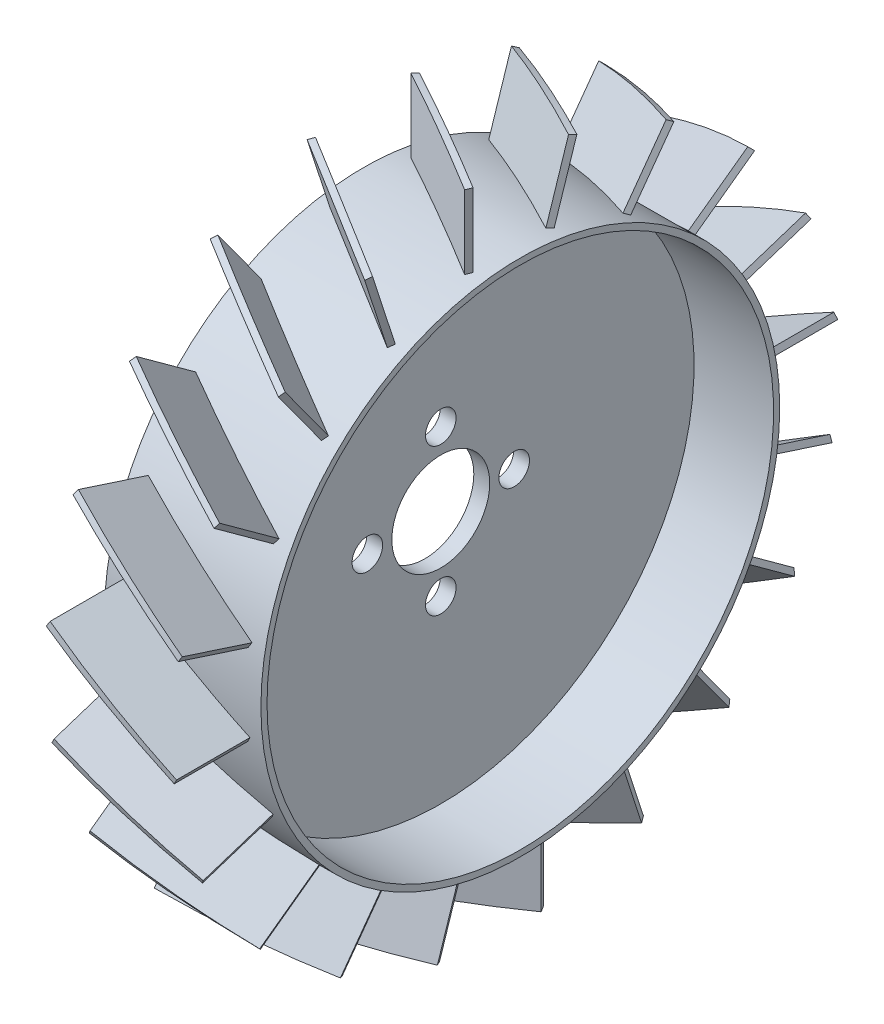
from build123d import *

# Parameters (mm, degrees)
BOSS_EXTRUDE1_REACH        = 166.386
BOSS_EXTRUDE1_START_RADIUS = 53.848
BOSS_EXTRUDE1_END_RADIUS   = 53.848
CIRPATTERN15_COUNT         = 20
SKETCH7_R                  = 3.175
SKETCH7_R_2                = 10.16
CUT_EXTRUDE1_DEPTH         = 100.090279987


with BuildPart() as part:
    # Sketch1 → Revolve1 (revolve)
    with BuildSketch(Plane(origin=(0, 0, 0), x_dir=(1, 0, 0), z_dir=(0, 1, 0))):
        Polygon((3.302, 0), (3.302, 52.578), (19.812, 52.578), (19.812, 53.848), (-12.7, 53.848), (-12.7, 52.578), (0, 52.578), (0, 0), align=None)
    revolve(axis=Axis((0, 0, 0), (1, 0, 0)))

    # Boss-Extrude1: from a cylinder face, 166.386 long prism both ways, kept between that surface and its translate by the depth
    boss_extrude1_start = Plane(origin=(3.556, 0, 0), z_dir=(-1, 0, 0)) * Cylinder(BOSS_EXTRUDE1_START_RADIUS, 441.468, mode=Mode.PRIVATE)
    boss_extrude1_end = Plane(origin=(3.556, 0, 15.24), z_dir=(-1, 0, 0)) * Cylinder(BOSS_EXTRUDE1_END_RADIUS, 441.468, mode=Mode.PRIVATE)
    # Sketch2 → Boss-Extrude1 (add, from a surface)
    with BuildSketch(Plane.XY.offset(83.82), mode=Mode.PRIVATE) as boss_extrude1_sk1:
        Polygon((-9.959727154, 7.070073869), (16.436727154, -8.169926131), (17.071727154, -7.070073869), (-9.324727154, 8.169926131), align=None)
    boss_extrude1_tool1 = extrude(boss_extrude1_sk1.sketch, amount=BOSS_EXTRUDE1_REACH, both=True, mode=Mode.PRIVATE)
    boss_extrude1 = ((boss_extrude1_tool1 - boss_extrude1_start) & boss_extrude1_end).solids().sort_by_distance((-12.7, 0, 53.848))[0]
    add(boss_extrude1)

    # CirPattern15: Boss-Extrude1 ×20 about axis
    cirpattern15_axis = Axis((19.812, 0, 0), (-1, 0, 0))
    for i in range(1, CIRPATTERN15_COUNT):
        add(boss_extrude1.rotate(cirpattern15_axis, i * 360 / CIRPATTERN15_COUNT))

    # Sketch7 → Cut-Extrude1 (cut, through all)
    with BuildSketch(Plane(origin=(3.302, 0, 0), x_dir=(0, 0, -1), z_dir=(1, 0, 0))):
        with Locations((0, 15.24)):
            Circle(SKETCH7_R)
        Circle(SKETCH7_R_2)
        with Locations((15.24, 0)):
            Circle(SKETCH7_R)
        with Locations((0, -15.24)):
            Circle(SKETCH7_R)
        with Locations((-15.24, 0)):
            Circle(SKETCH7_R)
    extrude(amount=-CUT_EXTRUDE1_DEPTH, mode=Mode.SUBTRACT)


solid = part.part
